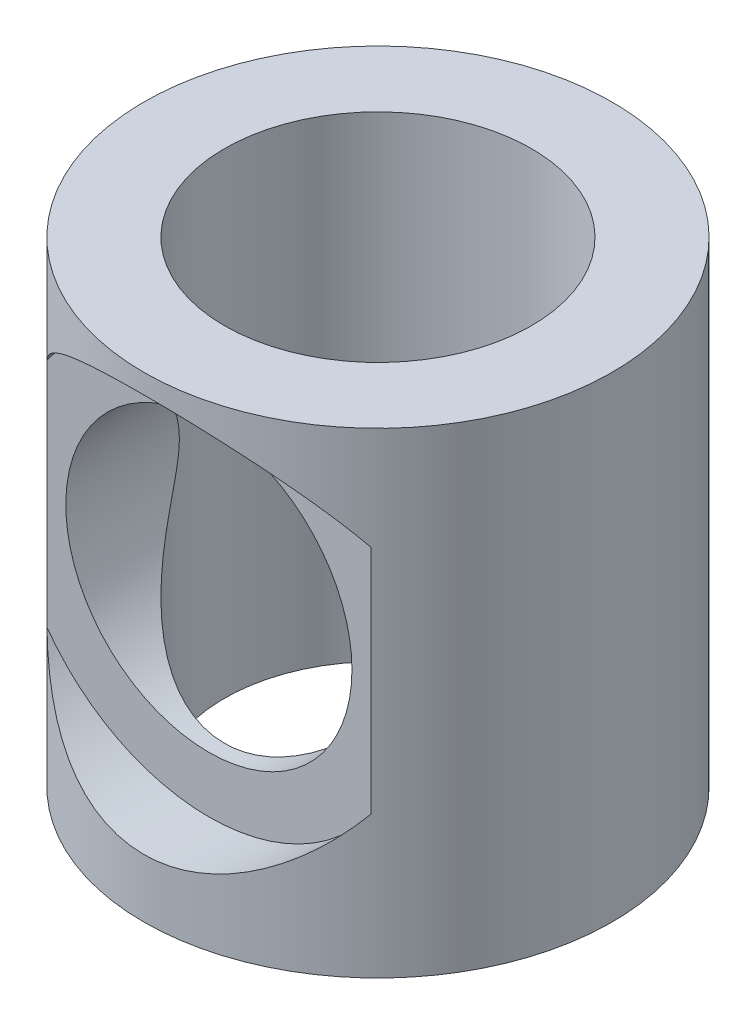
from build123d import *

# Parameters (mm, degrees)
SKETCH1_R               = 9
SKETCH1_R_2             = 5.9
BOSS_EXTRUDE1_DEPTH     = 18.3
CUT_EXTRUDE5_START      = 6.5
SKETCH3_R               = 7.65
CUT_EXTRUDE5_DEPTH      = 16.791029586
CUT_EXTRUDE6_DEPTH      = 26.615230012
CUT_EXTRUDE6_DEPTH_BACK = 7
SKETCH6_R               = 5.5


with BuildPart() as part:
    # Sketch1 → Boss-Extrude1 (new body)
    with BuildSketch(Plane(origin=(0, 0, 0), x_dir=(1, 0, 0), z_dir=(0, 1, 0))):
        Circle(SKETCH1_R)
        Circle(SKETCH1_R_2, mode=Mode.SUBTRACT)
    extrude(amount=-BOSS_EXTRUDE1_DEPTH)

    # Sketch3 → Cut-Extrude5 (cut, through all)
    with BuildSketch(Plane.XY.offset(CUT_EXTRUDE5_START)):
        with Locations((0, -8.4)):
            Circle(SKETCH3_R)
    extrude(amount=CUT_EXTRUDE5_DEPTH, mode=Mode.SUBTRACT)

    # Sketch6 → Cut-Extrude6 (cut, two sides: drawn at the far end of the back side and taken through both)
    with BuildSketch(Plane.XY.offset(6.5).offset(-CUT_EXTRUDE6_DEPTH_BACK)):
        with Locations((0, -8.4)):
            Circle(SKETCH6_R)
    extrude(amount=CUT_EXTRUDE6_DEPTH + CUT_EXTRUDE6_DEPTH_BACK, mode=Mode.SUBTRACT)


solid = part.part
